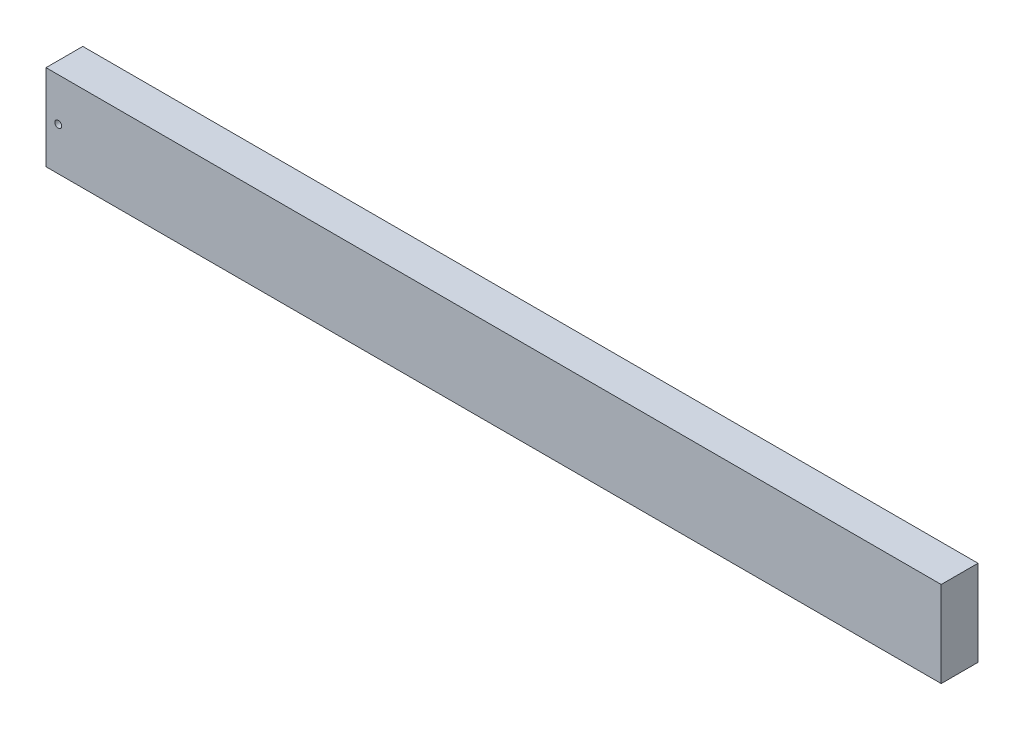
from build123d import *

# Parameters (mm, degrees)
SKETCH1_W                       = 38.1
SKETCH1_H                       = 88.9
BOSS_EXTRUDE1_DEPTH             = 927.1
F_9_32_0_28125_DIAMETER_HOLE1_D = 7.14375


with BuildPart() as part:
    # Sketch1 → Boss-Extrude1 (new body)
    with BuildSketch(Plane(origin=(0, 0, 0), x_dir=(0, 0, -1), z_dir=(1, 0, 0))):
        Rectangle(SKETCH1_W, SKETCH1_H)
    extrude(amount=BOSS_EXTRUDE1_DEPTH)

    # 9/32 (0.28125) Diameter Hole1 (through all)
    with Locations(Plane.XY.offset(19.05)):
        with Locations((12.7, 0)):
            Hole(F_9_32_0_28125_DIAMETER_HOLE1_D / 2)


solid = part.part
